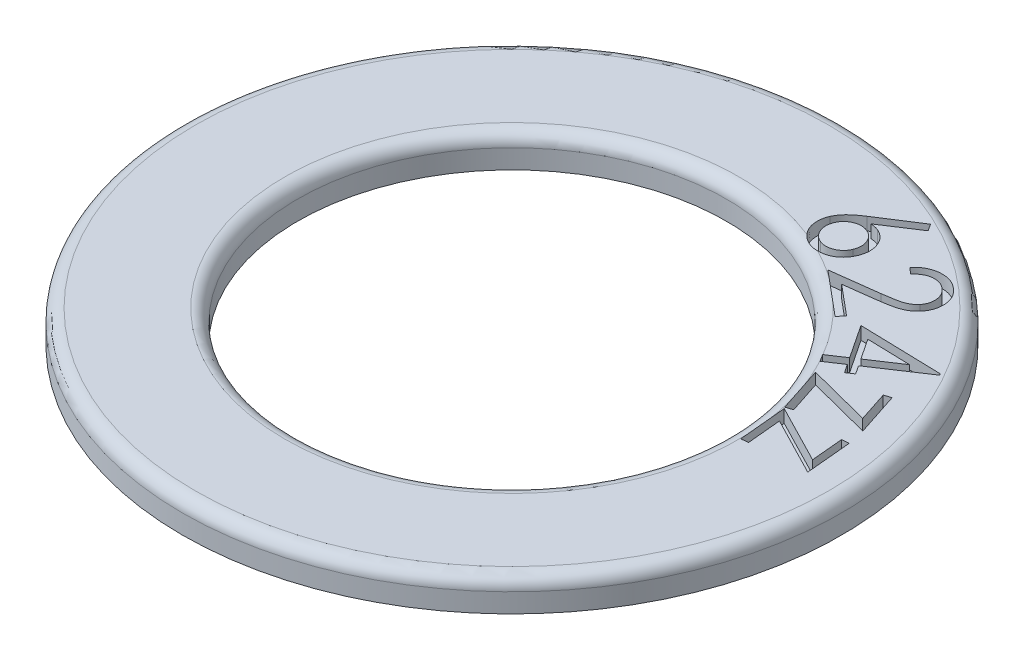
from build123d import *

# Parameters (mm, degrees)
CROQUIS1_R              = 5.15
CROQUIS1_R_2            = 3.35
SALIENTE_EXTRUIR1_DEPTH = 0.5
CORTAR_EXTRUIR1_DEPTH   = 0.2
REDONDEO1_R             = 0.2


with BuildPart() as part:
    # Croquis1 → Saliente-Extruir1 (new body)
    with BuildSketch(Plane(origin=(0, 0, 0), x_dir=(1, 0, 0), z_dir=(0, 1, 0))):
        with Locations(Location((0, 0, 0), (0, 0, 270))):
            Circle(CROQUIS1_R)
        with Locations(Location((0, 0, 0), (0, 0, 270))):
            Circle(CROQUIS1_R_2, mode=Mode.SUBTRACT)
    extrude(amount=SALIENTE_EXTRUIR1_DEPTH)

    # Croquis2 → Cortar-Extruir1 (cut)
    # profile 1 of 5: a face of its own
    with BuildSketch(Plane(origin=(0, 0.5, 0), x_dir=(1, 0, 0), z_dir=(0, 1, 0))):
        Polygon((4.466371723, 0.803519555), (4.53262356, 0.088794746), (3.619408248, 0.559977805), (3.668964622, 0.027048034), (3.557926544, 0.016712748), (3.48849462, 0.765358498), (4.402504953, 0.294440445), (4.356393675, 0.793449276), align=None)
    # profile 2 of 5: a face of its own
    with BuildSketch(Plane(origin=(0, 0.5, 0), x_dir=(1, 0, 0), z_dir=(0, 1, 0))):
        Polygon((4.184345421, 1.756163822), (4.406951591, 1.074829938), (3.412909039, 1.331357048), (3.579068645, 0.82307296), (3.473330714, 0.788622005), (3.239859243, 1.502551792), (4.234696816, 1.246024682), (4.079402512, 1.721977874), align=None)
    # profile 3 of 5: a face of its own
    with BuildSketch(Plane(origin=(0, 0.5, 0), x_dir=(1, 0, 0), z_dir=(0, 1, 0))):
        Polygon((4.238970957, 2.455320562), (4.253546361, 2.433059945), (3.489530185, 1.925305872), (3.577777631, 1.792537192), (3.472834723, 1.72284026), (3.384587277, 1.85560894), (3.129650211, 1.686269246), (3.056773191, 1.795982287), (3.311710257, 1.965321981), (2.963755613, 2.489241502), align=None)
        Polygon((3.416653165, 2.035018912), (3.873790836, 2.33871733), (3.202527231, 2.357532851), align=None, mode=Mode.SUBTRACT)
    # profile 4 of 5: a face of its own
    with BuildSketch(Plane(origin=(0, 0.5, 0), x_dir=(1, 0, 0), z_dir=(0, 1, 0))):
        with BuildLine():
            Line((2.654609151, 3.57623842), (2.557616462, 3.657330667))
            add(Edge.make_bspline(
                [(2.557616462, 3.657330667), (2.568474148, 3.668996415), (2.589781254, 3.691889258), (2.624356807, 3.722559549), (2.660663591, 3.748766406), (2.697967699, 3.77170499), (2.737361599, 3.789595319), (2.777893228, 3.804125448), (2.82003774, 3.814097565), (2.863061779, 3.820246642), (2.906283719, 3.821992943), (2.948896564, 3.820018673), (2.990461895, 3.81360422), (3.030900937, 3.803016334), (3.070187039, 3.787941628), (3.10839411, 3.768849549), (3.14545031, 3.745407184), (3.168617031, 3.727067378), (3.180383723, 3.717752342)],
                knots=[0, 0, 0, 0, 1.097131231, 2.153008532, 3.176348939, 4.177922017, 5.163234319, 6.15027287, 7.138866212, 8.140291478, 9.138885633, 10.113453524, 11.073636989, 12.02980358, 12.986763292, 13.96617981, 14.966995122, 16, 16, 16, 16], degree=3))
            add(Edge.make_bspline(
                [(3.180383723, 3.717752342), (3.191523175, 3.708057537), (3.213371851, 3.689042358), (3.242395079, 3.657654504), (3.26697418, 3.624573781), (3.288354961, 3.590605698), (3.304977507, 3.554713314), (3.318161972, 3.517597692), (3.326848492, 3.478884609), (3.33152469, 3.439272984), (3.332513138, 3.399629622), (3.330295643, 3.360747437), (3.324090209, 3.323225602), (3.314589446, 3.286865449), (3.301148896, 3.251790955), (3.284547735, 3.217753376), (3.263931967, 3.185180698), (3.247883199, 3.164896978), (3.239745368, 3.154611734)],
                knots=[0, 0, 0, 0, 1.120161151, 2.19705955, 3.236152738, 4.244516184, 5.237158078, 6.231518913, 7.22843006, 8.241218368, 9.253851355, 10.23446796, 11.192200629, 12.135322119, 13.081583392, 14.037977773, 15.005119545, 16, 16, 16, 16], degree=3))
            add(Edge.make_bspline(
                [(3.239745368, 3.154611734), (3.227450641, 3.140931322), (3.20305979, 3.113791487), (3.160566343, 3.079187571), (3.114178022, 3.050107998), (3.071933682, 3.030568276), (3.034911113, 3.017187741), (3.002993189, 3.007819638), (2.967393073, 2.998546352), (2.927903204, 2.989968207), (2.88476402, 2.981057022), (2.837612413, 2.973067398), (2.78675678, 2.964985171), (2.751525857, 2.960364522), (2.733316332, 2.957976284)],
                knots=[0, 0, 0, 0, 1.186326379, 2.353489327, 3.524729555, 4.714000951, 5.350982634, 6.065652757, 6.861209084, 7.726194831, 8.674878703, 9.705548307, 10.814085135, 12, 12, 12, 12], degree=3))
            Line((2.733316332, 2.957976284), (2.254713067, 2.896759587))
            Line((2.254713067, 2.896759587), (2.721391001, 2.506668775))
            Line((2.721391001, 2.506668775), (2.639768739, 2.409146072))
            Line((2.639768739, 2.409146072), (1.953134708, 2.983151981))
            Line((1.953134708, 2.983151981), (2.688265083, 3.077229589))
            add(Edge.make_bspline(
                [(2.688265083, 3.077229589), (2.706118358, 3.079456992), (2.740447171, 3.083739909), (2.789714023, 3.0910123), (2.834730354, 3.097971947), (2.875426469, 3.105509305), (2.91185238, 3.112811766), (2.944148707, 3.1201751), (2.972087228, 3.127778958), (3.003548693, 3.137829043), (3.038315824, 3.153124196), (3.076412607, 3.175342627), (3.110474977, 3.20265885), (3.130026466, 3.223956552), (3.139837599, 3.234643952)],
                knots=[0, 0, 0, 0, 1.321135128, 2.540318277, 3.656889327, 4.665846493, 5.579259773, 6.384898719, 7.097763894, 7.704960718, 8.808854139, 9.87907134, 10.935696736, 12, 12, 12, 12], degree=3))
            add(Edge.make_bspline(
                [(3.139837599, 3.234643952), (3.145454712, 3.241785466), (3.156591623, 3.25594477), (3.170652524, 3.27872477), (3.181839609, 3.302615157), (3.190589163, 3.327186479), (3.19684463, 3.352751599), (3.200086961, 3.379240045), (3.201345285, 3.406655666), (3.199242477, 3.434582132), (3.195228439, 3.462477869), (3.188278608, 3.489533497), (3.178920994, 3.515423016), (3.167316406, 3.540209998), (3.152815804, 3.563687814), (3.135819705, 3.58592288), (3.116369979, 3.607029219), (3.10188288, 3.619823479), (3.094521343, 3.626324808)],
                knots=[0, 0, 0, 0, 0.993954789, 1.970689749, 2.922214393, 3.876339036, 4.821406576, 5.796417209, 6.79304891, 7.820168494, 8.856665464, 9.874413114, 10.871466829, 11.86622075, 12.864492613, 13.88554167, 14.925550215, 16, 16, 16, 16], degree=3))
            add(Edge.make_bspline(
                [(3.094521343, 3.626324808), (3.086422242, 3.632758088), (3.070545447, 3.645369347), (3.045072214, 3.66127588), (3.019212223, 3.674711451), (2.992376652, 3.684758155), (2.965076438, 3.692275797), (2.937001276, 3.696799385), (2.908313932, 3.698370709), (2.879117113, 3.696983303), (2.849770669, 3.692876658), (2.820706039, 3.685256036), (2.791914034, 3.674909257), (2.763496016, 3.661344077), (2.735624422, 3.64442844), (2.707944766, 3.624735292), (2.680642702, 3.601972135), (2.663409611, 3.584937522), (2.654609151, 3.57623842)],
                knots=[0, 0, 0, 0, 1.006434913, 1.972930028, 2.919272708, 3.83945293, 4.757580478, 5.672519303, 6.602934726, 7.550097986, 8.514754053, 9.482779038, 10.470476726, 11.490058661, 12.543335957, 13.641257156, 14.795455728, 16, 16, 16, 16], degree=3))
        make_face()
    # profile 5 of 5: a face of its own
    with BuildSketch(Plane(origin=(0, 0.5, 0), x_dir=(1, 0, 0), z_dir=(0, 1, 0))):
        with BuildLine():
            Line((2.135782951, 4.40373951), (2.207334934, 4.296146528))
            Line((2.207334934, 4.296146528), (1.668309994, 3.943421752))
            add(Edge.make_bspline(
                [(1.668309994, 3.943421752), (1.680437673, 3.942193846), (1.70420512, 3.939787434), (1.738506623, 3.933147731), (1.770749365, 3.924228973), (1.790896642, 3.916134969), (1.800813667, 3.912150885)],
                knots=[0, 0, 0, 0, 1.069354313, 2.095687344, 3.062646789, 4, 4, 4, 4], degree=3))
            add(Edge.make_bspline(
                [(1.800813667, 3.912150885), (1.812399404, 3.906698086), (1.835215869, 3.895959571), (1.867274763, 3.876581407), (1.896166111, 3.854083237), (1.922756431, 3.829435664), (1.946094954, 3.801602983), (1.966761069, 3.771280587), (1.985028244, 3.738474586), (1.999812099, 3.703199605), (2.011751781, 3.666621169), (2.020079305, 3.629451211), (2.02428437, 3.592138093), (2.024834484, 3.554768094), (2.021611414, 3.51721894), (2.014630294, 3.479531194), (2.004114792, 3.441557894), (1.994080756, 3.416938994), (1.988968882, 3.404396812)],
                knots=[0, 0, 0, 0, 1.018467404, 2.005727057, 2.972967487, 3.927689722, 4.885253784, 5.856139333, 6.843999296, 7.867523201, 8.894444365, 9.902306128, 10.892738289, 11.876865406, 12.87150356, 13.88618031, 14.923107376, 16, 16, 16, 16], degree=3))
            add(Edge.make_bspline(
                [(1.988968882, 3.404396812), (1.981111385, 3.387633262), (1.965683899, 3.354719539), (1.935162969, 3.310118644), (1.89997285, 3.270475386), (1.859876999, 3.236317859), (1.815851921, 3.207780831), (1.768071817, 3.185858209), (1.717167801, 3.170460567), (1.663787268, 3.16180066), (1.60947555, 3.160039052), (1.555407724, 3.164713097), (1.502255232, 3.176601186), (1.468351215, 3.189744104), (1.451268978, 3.196366046)],
                knots=[0, 0, 0, 0, 1.035377197, 2.032869974, 3.013912163, 3.996375196, 4.97338044, 5.942879965, 6.930349417, 7.942878449, 8.962536529, 9.965778168, 10.975075427, 12, 12, 12, 12], degree=3))
            add(Edge.make_bspline(
                [(1.451268978, 3.196366046), (1.435237411, 3.204004843), (1.403506321, 3.219124222), (1.360015881, 3.248689401), (1.320962509, 3.283404742), (1.286899907, 3.323119323), (1.258158597, 3.366873213), (1.235759195, 3.413926939), (1.220211686, 3.463991305), (1.21160694, 3.516239435), (1.209778004, 3.569421303), (1.214650478, 3.622185708), (1.225772947, 3.673993822), (1.238630073, 3.706915932), (1.245093264, 3.723465656)],
                knots=[0, 0, 0, 0, 1.012889492, 2.004800029, 2.990883428, 3.988829313, 4.983557492, 5.97181883, 6.954593909, 7.967119095, 8.986656139, 9.984500034, 10.986821669, 12, 12, 12, 12], degree=3))
            add(Edge.make_bspline(
                [(1.245093264, 3.723465656), (1.250843474, 3.735793237), (1.262536606, 3.760861547), (1.28529763, 3.796610637), (1.311598176, 3.832029), (1.342650125, 3.867355921), (1.379818053, 3.903048393), (1.424499751, 3.939348073), (1.476210874, 3.978013003), (1.514192168, 4.002908575), (1.534216277, 4.016033765)],
                knots=[0, 0, 0, 0, 0.781314074, 1.588813072, 2.430852131, 3.316134131, 4.289493171, 5.389724546, 6.623837237, 8, 8, 8, 8], degree=3))
            Line((1.534216277, 4.016033765), (2.135782951, 4.40373951))
        make_face()
        with BuildLine():
            add(Edge.make_bspline(
                [(1.726081595, 3.8188683), (1.717403318, 3.822416424), (1.700327194, 3.829398018), (1.673793931, 3.836470246), (1.647355879, 3.841016558), (1.620814698, 3.842882229), (1.594244616, 3.842173249), (1.567637437, 3.838303652), (1.540956187, 3.83201477), (1.514750423, 3.822580506), (1.489204691, 3.811538791), (1.465413003, 3.797781248), (1.443416672, 3.782255208), (1.42342118, 3.764587707), (1.405239198, 3.745122432), (1.388989197, 3.72359031), (1.374949229, 3.699819742), (1.3670388, 3.682987471), (1.363021533, 3.674439297)],
                knots=[0, 0, 0, 0, 1.0338007, 2.03419516, 3.023075347, 3.990629336, 4.965961253, 5.950362161, 6.952939337, 7.985820285, 9.020218386, 10.020232756, 11.012997785, 11.986964511, 12.959564128, 13.948107872, 14.957958065, 16, 16, 16, 16], degree=3))
            add(Edge.make_bspline(
                [(1.363021533, 3.674439297), (1.359473408, 3.665761019), (1.352491814, 3.648684895), (1.345419586, 3.622151632), (1.340873276, 3.595713581), (1.339007598, 3.569172395), (1.339716603, 3.542602335), (1.343586105, 3.515995073), (1.349875353, 3.489314142), (1.359308202, 3.463107146), (1.370355183, 3.437565995), (1.384093744, 3.4137578), (1.399655472, 3.391869233), (1.417024768, 3.371692179), (1.436512552, 3.353601914), (1.457989628, 3.337421188), (1.481528194, 3.323298362), (1.498192904, 3.315393468), (1.506655514, 3.311379234)],
                knots=[0, 0, 0, 0, 1.035322852, 2.037190277, 3.027526476, 3.996505076, 4.973273058, 5.959123382, 6.963176736, 7.997578483, 9.033499615, 10.034986391, 11.029213152, 11.998191751, 12.972223409, 13.962222669, 14.965183654, 16, 16, 16, 16], degree=3))
            add(Edge.make_bspline(
                [(1.506655514, 3.311379234), (1.515333635, 3.307828741), (1.532409453, 3.300842485), (1.558944949, 3.293804225), (1.585369018, 3.289133068), (1.61193458, 3.287727385), (1.638490746, 3.288312994), (1.665100211, 3.292216032), (1.691780536, 3.298496047), (1.7179877, 3.307931458), (1.743528806, 3.31897775), (1.767337013, 3.33271649), (1.789225576, 3.348278171), (1.809402631, 3.36564748), (1.827492896, 3.38513526), (1.843673622, 3.406612337), (1.857796448, 3.430150903), (1.865701343, 3.446815613), (1.869715576, 3.455278222)],
                knots=[0, 0, 0, 0, 1.035364244, 2.037271722, 3.027647514, 3.996025188, 4.97283222, 5.958721958, 6.962815453, 7.997258554, 9.033221101, 10.034747916, 11.029014425, 11.998031763, 12.972102362, 13.962141201, 14.965142283, 16, 16, 16, 16], degree=3))
            add(Edge.make_bspline(
                [(1.869715576, 3.455278222), (1.873265232, 3.464045192), (1.880251868, 3.481300843), (1.887282406, 3.508016352), (1.891888006, 3.53461952), (1.893721001, 3.561252819), (1.893023361, 3.587909889), (1.889150531, 3.614517791), (1.88286069, 3.641197398), (1.873433826, 3.667409192), (1.862363605, 3.692932585), (1.848744827, 3.716742224), (1.832889446, 3.73840016), (1.815904553, 3.758824835), (1.796125754, 3.776638776), (1.774678759, 3.79278761), (1.751347547, 3.807293135), (1.734565298, 3.814981636), (1.726081595, 3.8188683)],
                knots=[0, 0, 0, 0, 1.043016542, 2.052924733, 3.0419078, 4.019288356, 4.994721743, 5.979225064, 6.981906543, 8.014894948, 9.049400662, 10.04951907, 11.034456805, 12.009500291, 12.975581836, 13.964228424, 14.970883932, 16, 16, 16, 16], degree=3))
        make_face(mode=Mode.SUBTRACT)
    extrude(amount=-CORTAR_EXTRUIR1_DEPTH, mode=Mode.SUBTRACT)

    # Redondeo1
    # the kernel refuses this fillet: 0.2 mm, written as the material it takes off along each edge
    with BuildSketch(Plane(origin=(0, 0.5, 0), x_dir=(0, 0, 1), z_dir=(-1, 0, 0))) as redondeo1_piece_1:
        with BuildLine():
            CenterArc((3.35 + REDONDEO1_R, -REDONDEO1_R), REDONDEO1_R, 90, 90)
            Line((3.35, -REDONDEO1_R), (3.35, 0))
            Line((3.35, 0), (3.35 + REDONDEO1_R, 0))
        make_face()
    revolve(axis=Axis((0, 0.5, 0), (0, 1, 0)), mode=Mode.SUBTRACT)
    with BuildSketch(Plane(origin=(0, 0.5, 0), x_dir=(0, 0, 1), z_dir=(-1, 0, 0))) as redondeo1_piece_2:
        with BuildLine():
            CenterArc((5.15 - REDONDEO1_R, -REDONDEO1_R), REDONDEO1_R, 0, 90)
            Line((5.15 - REDONDEO1_R, 0), (5.15, 0))
            Line((5.15, 0), (5.15, -REDONDEO1_R))
        make_face()
    revolve(axis=Axis((0, 0.5, 0), (0, 1, 0)), mode=Mode.SUBTRACT)


solid = part.part
